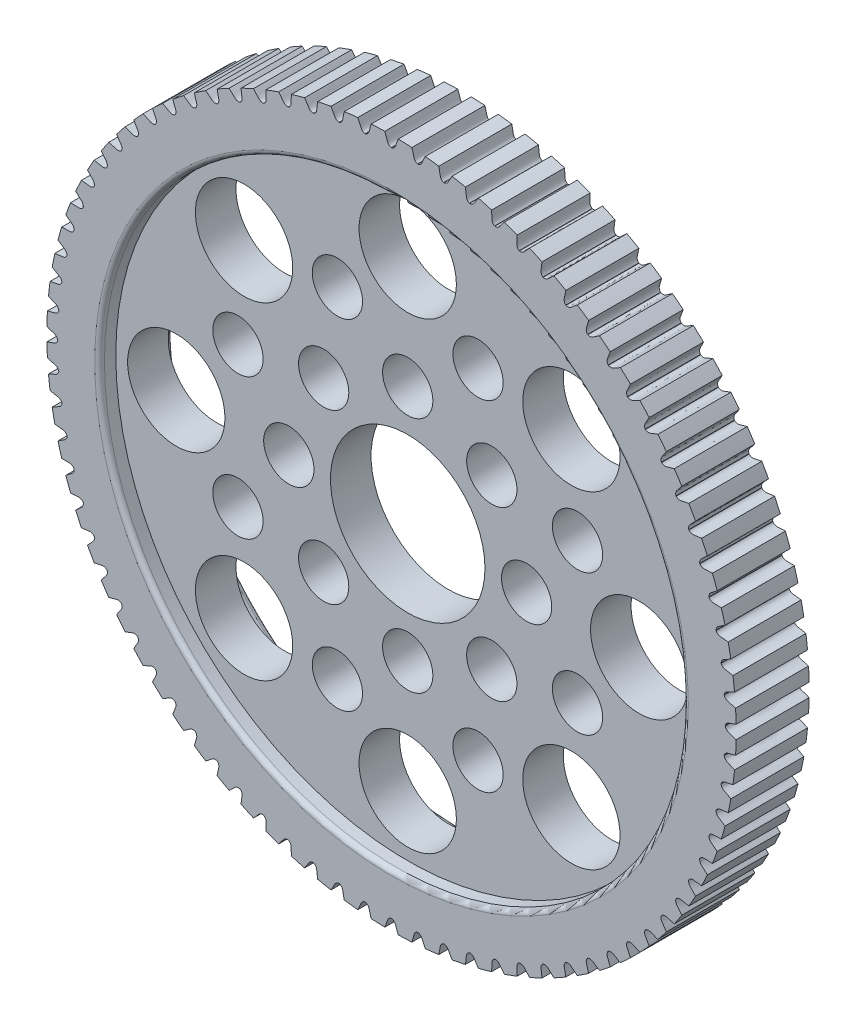
from build123d import *

# Parameters (mm, degrees)
SKETCH_1_R               = 21.25
EXTRUDE_1_DEPTH          = 4.5
CUT_EXTRUDE_1_DEPTH      = 31.387086073
PATTERN_CIRCULAR_1_COUNT = 80
SKETCH_4_R               = 4.7625
CUT_EXTRUDE_2_DEPTH      = 31.381495144
SKETCH_5_R               = 1.55
SKETCH_5_R_2             = 3
CUT_EXTRUDE_4_DEPTH      = 31.381495144
CUT_EXTRUDE_START        = 20.6
SKETCH_6_R               = 18
CUT_EXTRUDE_5_DEPTH      = 1
CUT_EXTRUDE_START_2      = 24.1
SKETCH_7_R               = 18
CUT_EXTRUDE_6_DEPTH      = 1
FILLET_1_R               = 0.3


with BuildPart() as part:
    # 草图1 → 凸台-拉伸1 (new body)
    with BuildSketch(Plane.XY):
        Circle(SKETCH_1_R)
    extrude(amount=EXTRUDE_1_DEPTH)

    # 草图2 → 切除-拉伸1 (cut, through all)
    with BuildSketch(Plane.XY):
        with BuildLine():
            ThreePointArc((0.01, 20.574759806), (0, 20.574762236), (-0.01, 20.574759806))
            add(Edge.make_bspline(
                [(-0.01, 20.574759806), (-0.216557459, 20.630239782), (-0.259283212, 20.830578336), (-0.341626669, 21.060184676), (-0.387546717, 21.184206083), (-0.43901345, 21.314087193), (-0.495879461, 21.449902815), (-0.558517481, 21.591413569), (-0.627143281, 21.738461172), (-0.702011774, 21.890853951), (-0.7833601, 22.048400073), (-0.871423739, 22.210898145), (-0.966431636, 22.378140088), (-1.068607337, 22.549910493), (-1.178168415, 22.725986986), (-1.295326388, 22.906140323), (-1.420286501, 23.090134555), (-1.553247552, 23.277727189), (-1.69440171, 23.46866935), (-1.843934355, 23.662705952), (-2.00202383, 23.85957587), (-2.227663128, 24.12933526), (-2.405493332, 24.329254486), (-2.528289837, 24.46201699)],
                knots=[0, 0, 0, 0, 0.101850053, 0.128531317, 0.156821359, 0.18672018, 0.218227778, 0.251344155, 0.28606931, 0.322403242, 0.360345953, 0.399897442, 0.441057709, 0.483826754, 0.528204578, 0.574191179, 0.621786558, 0.670990716, 0.721803651, 0.774225365, 0.828255856, 0.883895126, 1, 1, 1, 1], degree=3))
            ThreePointArc((-2.528289837, 24.46201699), (0, 24.592326541), (2.528289837, 24.46201699))
            add(Edge.make_bspline(
                [(0.01, 20.574759806), (0.216557459, 20.630239782), (0.259283212, 20.830578336), (0.341626669, 21.060184676), (0.387546717, 21.184206083), (0.43901345, 21.314087193), (0.495879461, 21.449902815), (0.558517481, 21.591413569), (0.627143281, 21.738461172), (0.702011774, 21.890853951), (0.7833601, 22.048400073), (0.871423739, 22.210898145), (0.966431636, 22.378140088), (1.068607337, 22.549910493), (1.178168415, 22.725986986), (1.295326388, 22.906140323), (1.420286501, 23.090134555), (1.553247552, 23.277727189), (1.69440171, 23.46866935), (1.843934355, 23.662705952), (2.00202383, 23.85957587), (2.227663128, 24.12933526), (2.405493332, 24.329254486), (2.528289837, 24.46201699)],
                knots=[0, 0, 0, 0, 0.101850053, 0.128531317, 0.156821359, 0.18672018, 0.218227778, 0.251344155, 0.28606931, 0.322403242, 0.360345953, 0.399897442, 0.441057709, 0.483826754, 0.528204578, 0.574191179, 0.621786558, 0.670990716, 0.721803651, 0.774225365, 0.828255856, 0.883895126, 1, 1, 1, 1], degree=3))
        make_face()
    cut_extrude_1 = extrude(amount=CUT_EXTRUDE_1_DEPTH, mode=Mode.SUBTRACT)

    # 阵列(圆周)1: 切除-拉伸1 ×80 about axis
    pattern_circular_1_axis = Axis((0, 0, 4.5), (0, 0, -1))
    for i in range(1, PATTERN_CIRCULAR_1_COUNT):
        add(cut_extrude_1.rotate(pattern_circular_1_axis, i * 360 / PATTERN_CIRCULAR_1_COUNT), mode=Mode.SUBTRACT)

    # 草图4 → 切除-拉伸2 (cut, through all)
    with BuildSketch(Plane.XY):
        Circle(SKETCH_4_R)
    extrude(amount=CUT_EXTRUDE_2_DEPTH, mode=Mode.SUBTRACT)

    # 草图5 → 切除-拉伸4 (cut, through all)
    with BuildSketch(Plane.XY):
        with Locations((0, 7.33)):
            Circle(SKETCH_5_R)
        with Locations((0, 14.27)):
            Circle(SKETCH_5_R_2)
        with Locations((10.090413768, 10.090413768)):
            Circle(SKETCH_5_R_2)
        with Locations((5.183092706, 5.183092706)):
            Circle(SKETCH_5_R)
        with Locations((14.27, 0)):
            Circle(SKETCH_5_R_2)
        with Locations((7.33, 0)):
            Circle(SKETCH_5_R)
        with Locations((10.090413768, -10.090413768)):
            Circle(SKETCH_5_R_2)
        with Locations((5.183092706, -5.183092706)):
            Circle(SKETCH_5_R)
        with Locations((0, -14.27)):
            Circle(SKETCH_5_R_2)
        with Locations((0, -7.33)):
            Circle(SKETCH_5_R)
        with Locations((-10.090413768, -10.090413768)):
            Circle(SKETCH_5_R_2)
        with Locations((-5.183092706, -5.183092706)):
            Circle(SKETCH_5_R)
        with Locations((-14.27, 0)):
            Circle(SKETCH_5_R_2)
        with Locations((-7.33, 0)):
            Circle(SKETCH_5_R)
        with Locations((-10.090413768, 10.090413768)):
            Circle(SKETCH_5_R_2)
        with Locations((-5.183092706, 5.183092706)):
            Circle(SKETCH_5_R)
        with Locations((4.335803289, 10.467555103)):
            Circle(SKETCH_5_R)
        with Locations((10.467555103, 4.335803289)):
            Circle(SKETCH_5_R)
        with Locations((10.467555103, -4.335803289)):
            Circle(SKETCH_5_R)
        with Locations((4.335803289, -10.467555103)):
            Circle(SKETCH_5_R)
        with Locations((-4.335803289, -10.467555103)):
            Circle(SKETCH_5_R)
        with Locations((-10.467555103, -4.335803289)):
            Circle(SKETCH_5_R)
        with Locations((-10.467555103, 4.335803289)):
            Circle(SKETCH_5_R)
        with Locations((-4.335803289, 10.467555103)):
            Circle(SKETCH_5_R)
    extrude(amount=CUT_EXTRUDE_4_DEPTH, mode=Mode.SUBTRACT)

    # 草图6 → 切除-拉伸5 (cut)
    with BuildSketch(Plane(origin=(33.43061164, 11.642774814, 25.1), x_dir=(-0.9443675604565376, -0.32889194389247045, 0), z_dir=(0, 0, -1)).offset(CUT_EXTRUDE_START)):
        with Locations(Location((35.4, 0, 0), (0, 0, 199.201534798))):
            Circle(SKETCH_6_R)
    extrude(amount=CUT_EXTRUDE_5_DEPTH, mode=Mode.SUBTRACT)

    # 草图7 → 切除-拉伸6 (cut)
    with BuildSketch(Plane(origin=(33.43061164, 11.642774814, 25.1), x_dir=(-0.9443675604565376, -0.32889194389247045, 0), z_dir=(0, 0, -1)).offset(CUT_EXTRUDE_START_2)):
        with Locations(Location((35.4, 0, 0), (0, 0, 199.201534798))):
            Circle(SKETCH_7_R)
    extrude(amount=CUT_EXTRUDE_6_DEPTH, mode=Mode.SUBTRACT)

    # 圆角1
    fillet_1_edges = [part.edges().sort_by_distance(p)[0] for p in [
        (-18, 0, 4.5),
        (-18, 0, 0),
    ]]
    fillet(fillet_1_edges, radius=FILLET_1_R)


solid = part.part
